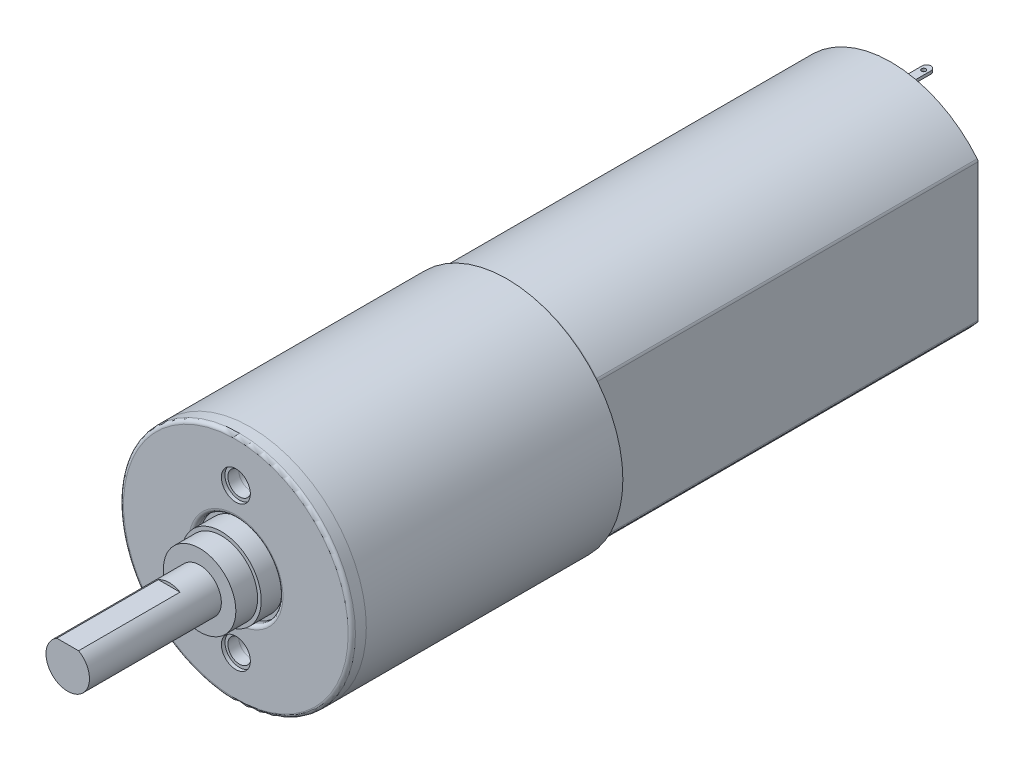
from build123d import *

# Parameters (mm, degrees)
SKETCH_1_R                       = 7.7
EXTRUDE_1_DEPTH                  = 26.5
CUT_EXTRUDE_1_DEPTH              = 29.65013089
FILLET_1_R                       = 0.25
SKETCH_4_R                       = 8
EXTRUDE_2_DEPTH                  = 17.7
SKETCH_5_R                       = 8
EXTRUDE_3_DEPTH                  = 1
SKETCH_6_R                       = 3
CUT_EXTRUDE_2_DEPTH              = 0.5
FILLET_3_R                       = 0.25
SKETCH_7_R                       = 2.75
EXTRUDE_4_DEPTH                  = 1.5
SKETCH_8_R                       = 2.5
EXTRUDE_5_DEPTH                  = 1.5
SKETCH_9_R                       = 1.5
EXTRUDE_6_DEPTH                  = 9.1
CUT_EXTRUDE_3_DEPTH              = 7
M2X0_4_1_AT_2_COUNT              = 2
M2X0_4_1_AT_2_PITCH              = 10
SKETCH_16_R                      = 1
CUT_EXTRUDE_4_DEPTH              = 0.25
CUT_EXTRUDE_5_DEPTH              = 0.75
SKETCH_18_R                      = 2.5
EXTRUDE_7_DEPTH                  = 2.5
FILLET_4_R                       = 0.25
SKETCH_19_R                      = 0.5
EXTRUDE_8_DEPTH                  = 0.5
SKETCH_20_W                      = 0.6
SKETCH_20_H                      = 0.2
EXTRUDE_9_DEPTH                  = 3
SKETCH_21_R                      = 0.15
CUT_EXTRUDE_6_DEPTH              = 60.02075906
FILLET_5_R                       = 0.3
PATTERN_CIRCULAR_1_COUNT         = 2
FILLET_5_OF_PATTERN_CIRCULAR_1_R = 0.3


with BuildPart() as part:
    # 草圖1 → 填料-伸長1 (new body)
    with BuildSketch(Plane.XY):
        Circle(SKETCH_1_R)
    extrude(amount=EXTRUDE_1_DEPTH)

    # 草圖2 → 除料-伸長1 (cut, through all)
    with BuildSketch(Plane.XY.offset(26.5)):
        with BuildLine():
            Line((-6, -4.825971405), (-6, 4.825971405))
            ThreePointArc((-6, 4.825971405), (-7.7, 0), (-6, -4.825971405))
        make_face()
        with BuildLine():
            ThreePointArc((7.7, 0), (7.262575301, 2.558319761), (6, 4.825971405))
            Line((6, 4.825971405), (6, -4.825971405))
            ThreePointArc((6, -4.825971405), (7.262575301, -2.558319761), (7.7, 0))
        make_face()
    extrude(amount=-CUT_EXTRUDE_1_DEPTH, mode=Mode.SUBTRACT)

    # 圓角1
    fillet_1_edges = [part.edges().sort_by_distance(p)[0] for p in [
        (-6, 0, 26.5),
        (-6, 4.825971405, 13.25),
        (-6, -4.825971405, 13.25),
        (6, 4.825971405, 13.25),
        (6, -4.825971405, 13.25),
        (6, 0, 26.5),
        (0, 7.7, 26.5),
        (0, -7.7, 26.5),
    ]]
    fillet(fillet_1_edges, radius=FILLET_1_R)

    # 草圖4 → 填料-伸長2 (add)
    with BuildSketch(Plane.XY.offset(26.5)):
        Circle(SKETCH_4_R)
    extrude(amount=EXTRUDE_2_DEPTH)


with BuildPart() as body_2:
    # 草圖5 → 填料-伸長3 (new body)
    with BuildSketch(Plane.XY.offset(44.2)):
        Circle(SKETCH_5_R)
    extrude(amount=EXTRUDE_3_DEPTH)

    # 草圖6 → 除料-伸長2 (cut)
    with BuildSketch(Plane.XY.offset(45.2)):
        Circle(SKETCH_6_R)
    extrude(amount=-CUT_EXTRUDE_2_DEPTH, mode=Mode.SUBTRACT)

    # 圓角3
    fillet_3_edges = [body_2.edges().sort_by_distance(p)[0] for p in [
        (-8, 0, 45.2),
        (-3, 0, 45.2),
    ]]
    fillet(fillet_3_edges, radius=FILLET_3_R)

    # 草圖7 → 填料-伸長4 (add)
    with BuildSketch(Plane.XY.offset(44.7)):
        Circle(SKETCH_7_R)
    extrude(amount=EXTRUDE_4_DEPTH)


with BuildPart() as body_3:
    # 草圖8 → 填料-伸長5 (new body)
    with BuildSketch(Plane.XY.offset(46.2)):
        Circle(SKETCH_8_R)
    extrude(amount=EXTRUDE_5_DEPTH)

    # 草圖9 → 填料-伸長6 (add)
    with BuildSketch(Plane.XY.offset(47.7)):
        Circle(SKETCH_9_R)
    extrude(amount=EXTRUDE_6_DEPTH)

    # 草圖10 → 除料-伸長3 (cut)
    with BuildSketch(Plane.XY.offset(56.8)):
        with BuildLine():
            Line((-0.748331477, 1.3), (0.748331477, 1.3))
            ThreePointArc((0.748331477, 1.3), (0, 1.5), (-0.748331477, 1.3))
        make_face()
    extrude(amount=-CUT_EXTRUDE_3_DEPTH, mode=Mode.SUBTRACT)


with BuildPart() as m2x0_4_1_tool:
    # 草圖15 → M2x0.4 螺紋孔1 (revolve)
    with BuildSketch(Plane(origin=(0, -5, 45.2), x_dir=(0, -1, 0), z_dir=(1, 0, 0))):
        Polygon((0, 0), (0, 3.480688495), (0.8, 3), (0.8, 0), align=None)
    m2x0_4_1 = revolve(axis=Axis((0, -5, 51.55), (0, 0, -1)))


with BuildPart() as part_1:
    add(part.part)

    # M2x0.4 螺紋孔1: cut by m2x0_4_1_tool
    add(m2x0_4_1_tool.part, mode=Mode.SUBTRACT)


with BuildPart() as body_2_1:
    add(body_2.part)

    # M2x0.4 螺紋孔1: cut by m2x0_4_1_tool
    add(m2x0_4_1_tool.part, mode=Mode.SUBTRACT)


with BuildPart() as m2x0_4_1_at_2_tool:
    # M2x0.4 螺紋孔1 at 2: M2x0.4 螺紋孔1 ×2
    with Locations(*[(0, i * M2X0_4_1_AT_2_PITCH, 0) for i in range(1, M2X0_4_1_AT_2_COUNT)]):
        add(m2x0_4_1)


with BuildPart() as part_2:
    add(part_1.part)

    # M2x0.4 螺紋孔1 at 2: cut by m2x0_4_1_at_2_tool
    add(m2x0_4_1_at_2_tool.part, mode=Mode.SUBTRACT)

    # 草圖17 → 除料-伸長5 (cut)
    with BuildSketch(Plane(origin=(0, 0, 0), x_dir=(-1, 0, 0), z_dir=(0, 0, -1))):
        with BuildLine():
            Line((-5.75, 4.631978395), (-5.75, -4.631978395))
            ThreePointArc((-5.75, -4.631978395), (0, -7.383611844), (5.75, -4.631978395))
            Line((5.75, -4.631978395), (5.75, 4.631978395))
            ThreePointArc((5.75, 4.631978395), (0, 7.383611844), (-5.75, 4.631978395))
        make_face()
    extrude(amount=-CUT_EXTRUDE_5_DEPTH, mode=Mode.SUBTRACT)

    # 草圖18 → 填料-伸長7 (add)
    with BuildSketch(Plane(origin=(0, 0, 0.75), x_dir=(-1, 0, 0), z_dir=(0, 0, -1))):
        with Locations(Location((0, 0, 0), (0, 0, 180))):
            Circle(SKETCH_18_R)
    extrude(amount=EXTRUDE_7_DEPTH)

    # 圓角4
    fillet_4_edges = [part_2.edges().sort_by_distance(p)[0] for p in [
        (-2.5, 0, -1.75),
    ]]
    fillet(fillet_4_edges, radius=FILLET_4_R)

    # 草圖19 → 填料-伸長8 (add)
    with BuildSketch(Plane(origin=(0, 0, 0.75), x_dir=(-1, 0, 0), z_dir=(0, 0, -1))):
        with Locations((0, 6)):
            Circle(SKETCH_19_R)
    extrude_8 = extrude(amount=EXTRUDE_8_DEPTH)

    # 草圖20 → 填料-伸長9 (add)
    with BuildSketch(Plane(origin=(0, 0, 0.25), x_dir=(-1, 0, 0), z_dir=(0, 0, -1))):
        with Locations((0, 6)):
            Rectangle(SKETCH_20_W, SKETCH_20_H)
    extrude_9 = extrude(amount=EXTRUDE_9_DEPTH)

    # 草圖21 → 除料-伸長6 (cut, through all)
    with BuildSketch(Plane.XZ.offset(-5.9)):
        with Locations(Location((0, -2.25, 0), (0, 0, 270))):
            Circle(SKETCH_21_R)
    cut_extrude_6 = extrude(amount=-CUT_EXTRUDE_6_DEPTH, mode=Mode.SUBTRACT)

    # 圓角5
    fillet_5_edges = [part_2.edges().sort_by_distance(p)[0] for p in [
        (-0.3, 6, -2.75),
        (0.3, 6, -2.75),
    ]]
    fillet(fillet_5_edges, radius=FILLET_5_R - 0.0001)  # a hair under: the kernel refuses the full size

    # 環狀複製排列1: 填料-伸長8, 填料-伸長9, 除料-伸長6 ×2 about axis
    pattern_circular_1_axis = Axis((0, 0, 0), (0, 0, 1))
    add([extrude_8.rotate(pattern_circular_1_axis, i * 360 / PATTERN_CIRCULAR_1_COUNT) for i in range(1, PATTERN_CIRCULAR_1_COUNT)])
    add([extrude_9.rotate(pattern_circular_1_axis, i * 360 / PATTERN_CIRCULAR_1_COUNT) for i in range(1, PATTERN_CIRCULAR_1_COUNT)])
    add([cut_extrude_6.rotate(pattern_circular_1_axis, i * 360 / PATTERN_CIRCULAR_1_COUNT) for i in range(1, PATTERN_CIRCULAR_1_COUNT)], mode=Mode.SUBTRACT)

    # 圓角5 of 環狀複製排列1
    fillet_5_of_pattern_circular_1_edges = [part_2.edges().sort_by_distance(p)[0] for p in [
        (0.3, -6, -2.75),
        (-0.3, -6, -2.75),
    ]]
    fillet(fillet_5_of_pattern_circular_1_edges, radius=FILLET_5_OF_PATTERN_CIRCULAR_1_R - 0.0001)  # a hair under: the kernel refuses the full size


with BuildPart() as body_2_2:
    add(body_2_1.part)

    # M2x0.4 螺紋孔1 at 2: cut by m2x0_4_1_at_2_tool
    add(m2x0_4_1_at_2_tool.part, mode=Mode.SUBTRACT)

    # 草圖16 → 除料-伸長4 (cut)
    with BuildSketch(Plane.XY.offset(45.2)):
        with Locations((0, -5)):
            Circle(SKETCH_16_R)
        with Locations((0, 5)):
            Circle(SKETCH_16_R)
    extrude(amount=-CUT_EXTRUDE_4_DEPTH, mode=Mode.SUBTRACT)


solid = Compound([body_3.part, part_2.part, body_2_2.part])
